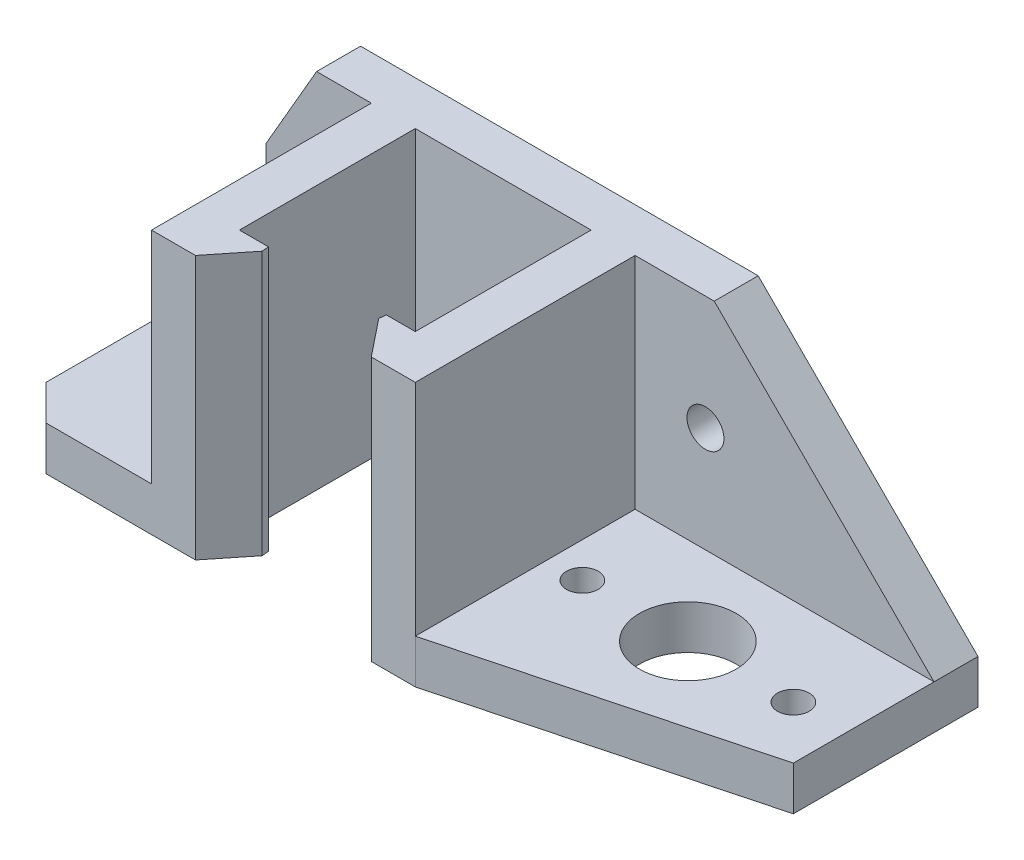
from build123d import *
from OCP.BRepFilletAPI import BRepFilletAPI_MakeChamfer

# Parameters (mm, degrees)
SKETCH1_W           = 30
SKETCH1_H           = 30
BOSS_EXTRUDE1_DEPTH = 30
SKETCH2_W           = 20
SKETCH2_H           = 20
CUT_EXTRUDE1_DEPTH  = 37.742346142
SKETCH3_W           = 30
SKETCH3_H           = 5
BOSS_EXTRUDE2_DEPTH = 40
SKETCH4_R           = 5.5
SKETCH4_R_2         = 1.8
CUT_EXTRUDE2_DEPTH  = 65.420493634
CUT_EXTRUDE3_DEPTH  = 63.24949799
SKETCH5_W           = 5
SKETCH5_H           = 25
BOSS_EXTRUDE4_DEPTH = 34
CHAMFER1_SIZE       = 25
SKETCH8_R           = 2.1
CUT_EXTRUDE4_DEPTH  = 63.657800791
SKETCH9_W           = 5
SKETCH9_H           = 30
BOSS_EXTRUDE5_DEPTH = 12
CHAMFER2_SIZE       = 10
CHAMFER2_SIZE2      = 5.773502692
SKETCH10_R          = 2.1
CUT_EXTRUDE5_DEPTH  = 63.657800791
SKETCH11_W          = 25
SKETCH11_H          = 5
BOSS_EXTRUDE6_DEPTH = 16
CHAMFER3_SIZE       = 4
SKETCH12_R          = 1.8
CUT_EXTRUDE6_DEPTH  = 58.017541161
CUT_EXTRUDE7_DEPTH  = 3
CUT_EXTRUDE8_DEPTH  = 60.380131357
CHAMFER4_SIZE       = 1
CHAMFER4_SIZE2      = 0.711458249


with BuildPart() as part:
    # Sketch1 → Boss-Extrude1 (new body)
    with BuildSketch(Plane(origin=(0, 0, 0), x_dir=(1, 0, 0), z_dir=(0, 1, 0))):
        Rectangle(SKETCH1_W, SKETCH1_H)
    extrude(amount=BOSS_EXTRUDE1_DEPTH)

    # Sketch2 → Cut-Extrude1 (cut, through all)
    with BuildSketch(Plane(origin=(0, 30, 0), x_dir=(1, 0, 0), z_dir=(0, 1, 0))):
        Rectangle(SKETCH2_W, SKETCH2_H)
    extrude(amount=-CUT_EXTRUDE1_DEPTH, mode=Mode.SUBTRACT)

    # Sketch3 → Boss-Extrude2 (add)
    with BuildSketch(Plane(origin=(15, 0, 0), x_dir=(0, 0, -1), z_dir=(1, 0, 0))):
        with Locations((0, 2.5)):
            Rectangle(SKETCH3_W, SKETCH3_H)
    extrude(amount=BOSS_EXTRUDE2_DEPTH)

    # Sketch4 → Cut-Extrude2 (cut, through all)
    with BuildSketch(Plane.XZ):
        with Locations(Location((31, 0, 0), (0, 0, 270))):
            Circle(SKETCH4_R)
        with Locations(Location((19, 0, 0), (0, 0, 270))):
            Circle(SKETCH4_R_2)
        with Locations(Location((43, 0, 0), (0, 0, 270))):
            Circle(SKETCH4_R_2)
    extrude(amount=-CUT_EXTRUDE2_DEPTH, mode=Mode.SUBTRACT)

    # Sketch7 → Cut-Extrude3 (cut, through all)
    with BuildSketch(Plane(origin=(0, 5, 0), x_dir=(1, 0, 0), z_dir=(0, 1, 0))):
        Polygon((15, -15), (49, -6), (49, 15), (55, 15), (55, -15), align=None)
    extrude(amount=-CUT_EXTRUDE3_DEPTH, mode=Mode.SUBTRACT)

    # Sketch5 → Boss-Extrude4 (add)
    with BuildSketch(Plane(origin=(15, 0, 0), x_dir=(0, 0, -1), z_dir=(1, 0, 0))):
        with Locations((12.5, 17.5)):
            Rectangle(SKETCH5_W, SKETCH5_H)
    extrude(amount=BOSS_EXTRUDE4_DEPTH)

    # Chamfer1
    chamfer1_edges = [part.edges().sort_by_distance(p)[0] for p in [
        (49, 30, -12.5),
    ]]
    chamfer(chamfer1_edges, length=CHAMFER1_SIZE)

    # Sketch8 → Cut-Extrude4 (cut, through all)
    with BuildSketch(Plane.XY.offset(-10)):
        with Locations((23, 17)):
            Circle(SKETCH8_R)
    extrude(amount=-CUT_EXTRUDE4_DEPTH, mode=Mode.SUBTRACT)

    # Sketch9 → Boss-Extrude5 (add)
    with BuildSketch(Plane.ZY.offset(15)):
        with Locations((-12.5, 15)):
            Rectangle(SKETCH9_W, SKETCH9_H)
    extrude(amount=BOSS_EXTRUDE5_DEPTH)

    # Chamfer2
    chamfer2_edges = [part.edges().sort_by_distance(p)[0] for p in [
        (-27, 30, -12.5),
    ]]
    chamfer2_side = [part.faces().sort_by_distance(p)[0] for p in [
        (-27, 15, -12.5),
    ]]
    chamfer(chamfer2_edges, length=CHAMFER2_SIZE, length2=CHAMFER2_SIZE2, reference=chamfer2_side[0])

    # Sketch10 → Cut-Extrude5 (cut, through all)
    with BuildSketch(Plane.XY.offset(-10)):
        with Locations((-21, 17)):
            Circle(SKETCH10_R)
    extrude(amount=-CUT_EXTRUDE5_DEPTH, mode=Mode.SUBTRACT)

    # Sketch11 → Boss-Extrude6 (add)
    with BuildSketch(Plane.ZY.offset(15)):
        with Locations((2.5, 2.5)):
            Rectangle(SKETCH11_W, SKETCH11_H)
    extrude(amount=BOSS_EXTRUDE6_DEPTH)

    # Chamfer3
    chamfer3_edges = [part.edges().sort_by_distance(p)[0] for p in [
        (-31, 2.5, 15),
        (-31, 2.5, -10),
    ]]
    chamfer(chamfer3_edges, length=CHAMFER3_SIZE - 0.0001)  # a hair under: the kernel refuses the full size

    # Sketch12 → Cut-Extrude6 (cut, through all)
    with BuildSketch(Plane(origin=(0, 5, 0), x_dir=(1, 0, 0), z_dir=(0, 1, 0))):
        with Locations(Location((-25, 0, 0), (0, 0, 270))):
            Circle(SKETCH12_R)
    extrude(amount=-CUT_EXTRUDE6_DEPTH, mode=Mode.SUBTRACT)

    # Sketch13 → Cut-Extrude7 (cut)
    with BuildSketch(Plane(origin=(0, 5, 0), x_dir=(1, 0, 0), z_dir=(0, 1, 0))):
        Polygon((-25, -3.464101615), (-22, -1.732050808), (-22, 1.732050808), (-25, 3.464101615), (-28, 1.732050808), (-28, -1.732050808), align=None)
    extrude(amount=-CUT_EXTRUDE7_DEPTH, mode=Mode.SUBTRACT)

    # Sketch14 → Cut-Extrude8 (cut, through all)
    with BuildSketch(Plane(origin=(0, 30, 0), x_dir=(1, 0, 0), z_dir=(0, 1, 0))):
        Polygon((-6, -10), (-10, -15), (10, -15), (6, -10), align=None)
    extrude(amount=-CUT_EXTRUDE8_DEPTH, mode=Mode.SUBTRACT)

    # Chamfer4: one chamfer whose edges measure the first distance from different faces: ONE call of the kernel's chamfer builder (chamfer() names one face for all edges)
    chamfer4_edges_1 = [part.edges().sort_by_distance(p)[0] for p in [
        (-6, 15, 10),
    ]]
    chamfer4_side_1 = [part.faces().sort_by_distance(p)[0] for p in [
        (-8, 15, 12.5),
    ]]
    chamfer4_edges_2 = [part.edges().sort_by_distance(p)[0] for p in [
        (6, 15, 10),
    ]]
    chamfer4_side_2 = [part.faces().sort_by_distance(p)[0] for p in [
        (8, 15, 12.5),
    ]]
    chamfer4 = BRepFilletAPI_MakeChamfer(part.part.solid().wrapped)
    for e in chamfer4_edges_1:
        chamfer4.Add(CHAMFER4_SIZE, CHAMFER4_SIZE2, e.wrapped, chamfer4_side_1[0].wrapped)  # the first distance lies on this face
    for e in chamfer4_edges_2:
        chamfer4.Add(CHAMFER4_SIZE, CHAMFER4_SIZE2, e.wrapped, chamfer4_side_2[0].wrapped)  # the first distance lies on this face
    add(Compound.cast(chamfer4.Shape()), mode=Mode.REPLACE)


solid = part.part
